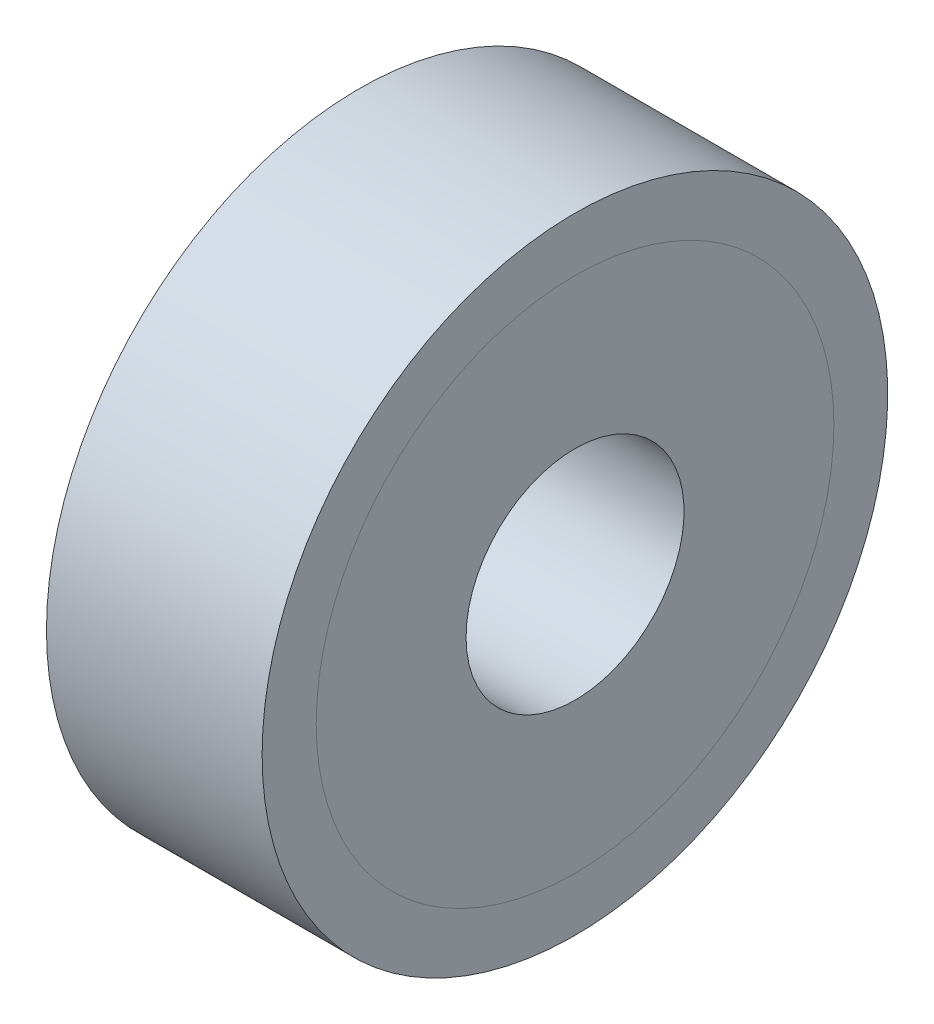
from build123d import *


with BuildPart() as part:
    # Sketch1 → Revolve1 (revolve)
    with BuildSketch(Plane(origin=(0, 0, 0), x_dir=(1, 0, 0), z_dir=(0, 1, 0))):
        Polygon((15.871181666, 23.02), (11.91, 23.02), (3.97, 23.02), (0, 23.02), (0, 19.05), (0, 10.298071399), (0, 9.525), (0, 8.02), (15.88, 8.02), (15.88, 9.525), (15.88, 19.05), align=None)
    revolve(axis=Axis((0, 0, 0), (1, 0, 0)))


solid = part.part
